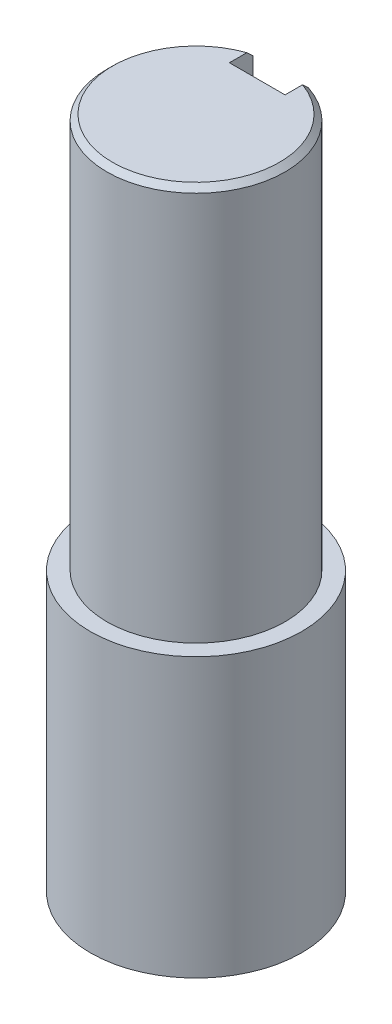
from build123d import *

# Parameters (mm, degrees)
SKETCH1_R           = 16
BOSS_EXTRUDE1_DEPTH = 71
SKETCH2_W           = 10
SKETCH2_H           = 10
CUT_EXTRUDE1_DEPTH  = 66
SKETCH3_R           = 19
BOSS_EXTRUDE2_DEPTH = 50
CHAMFER1_SIZE       = 1


with BuildPart() as part:
    # Sketch1 → Boss-Extrude1 (new body)
    with BuildSketch(Plane(origin=(0, 0, 0), x_dir=(1, 0, 0), z_dir=(0, 1, 0))):
        Circle(SKETCH1_R)
    extrude(amount=BOSS_EXTRUDE1_DEPTH)

    # Sketch2 → Cut-Extrude1 (cut)
    with BuildSketch(Plane(origin=(0, 71, 0), x_dir=(1, 0, 0), z_dir=(0, 1, 0))):
        with Locations((0, 16)):
            Rectangle(SKETCH2_W, SKETCH2_H)
    extrude(amount=-CUT_EXTRUDE1_DEPTH, mode=Mode.SUBTRACT)

    # Sketch3 → Boss-Extrude2 (add)
    with BuildSketch(Plane.XZ):
        Circle(SKETCH3_R)
    extrude(amount=BOSS_EXTRUDE2_DEPTH)

    # Chamfer1
    chamfer1_edges = [part.edges().sort_by_distance(p)[0] for p in [
        (-9.38083152, 71, 12.961481397),
    ]]
    chamfer(chamfer1_edges, length=CHAMFER1_SIZE)


solid = part.part
